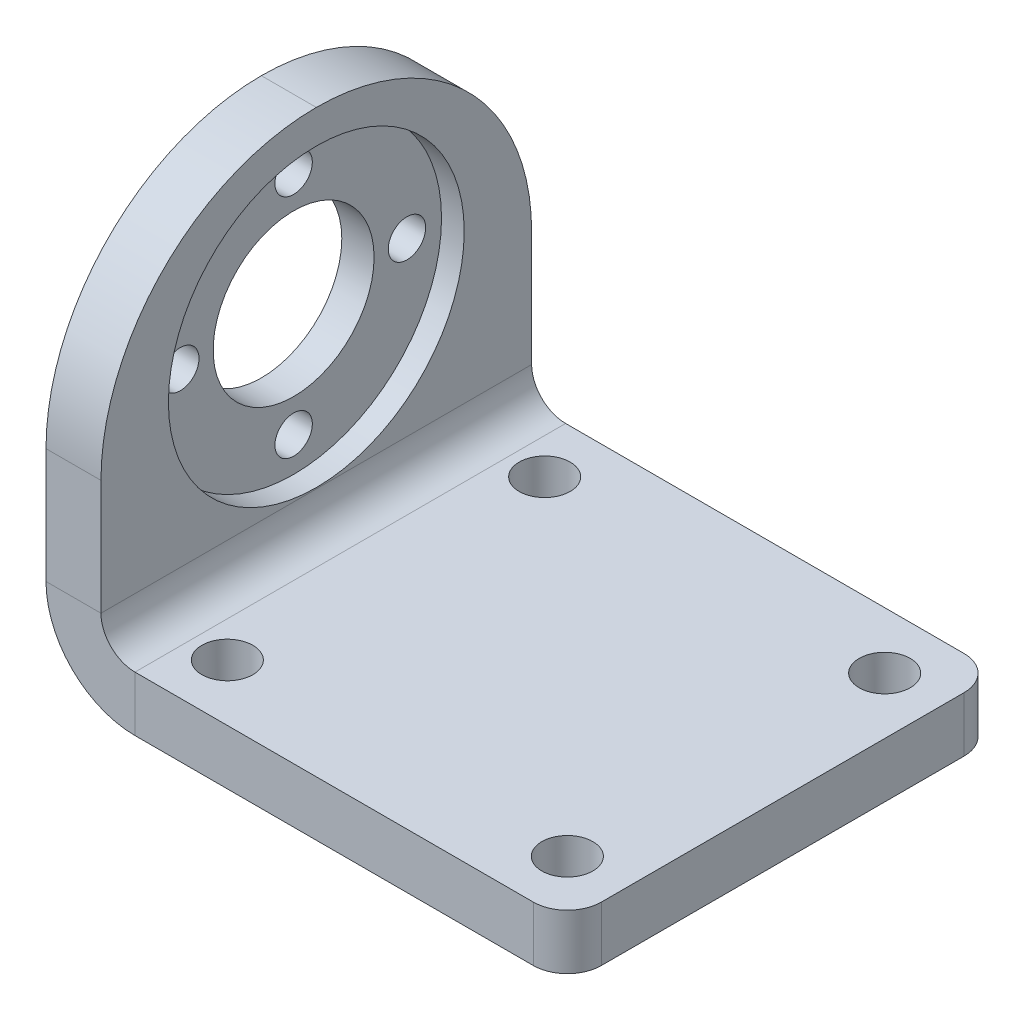
from build123d import *

# Parameters (mm, degrees)
T_LE_DE_BASE_PLI_E1_DEPTH    = 38
ENL_V_MAT_EXTRU_1_DEPTH      = 68.129147917
ENL_V_MAT_EXTRU_1_DEPTH_BACK = 68.129147917
ESQUISSE6_R                  = 7.1
ESQUISSE7_R                  = 13.05
ENL_V_MAT_EXTRU_2_DEPTH      = 2
CONG_1_R                     = 19
ENL_V_MAT_EXTRU_3_DEPTH      = 69.373404917
ENL_V_MAT_EXTRU_3_DEPTH_BACK = 69.373404917
ESQUISSE8_R                  = 1.65
ENL_V_MAT_EXTRU_4_DEPTH      = 68.77626797
ENL_V_MAT_EXTRU_4_DEPTH_BACK = 68.77626797
ESQUISSE9_R                  = 2.25
CONG_2_R                     = 3


# Read off the part's stored shape, not the designer's step: Tôle de base pliée1
with BuildPart() as part:
    # Tôle de base pliée1 outline → Tôle de base pliée1 (new body)
    with BuildSketch(Plane.XY):
        with BuildLine():
            Line((4.85, 7.85), (4.85, 37))
            Line((4.85, 37), (0, 37))
            Line((0, 37), (0, 7.85))
            ThreePointArc((0, 7.85), (2.299211768, 2.299211768), (7.85, 0))
            Line((7.85, 0), (46, 0))
            Line((46, 0), (46, 4.85))
            Line((46, 4.85), (7.85, 4.85))
            ThreePointArc((7.85, 4.85), (5.728679656, 5.728679656), (4.85, 7.85))
        make_face()
    extrude(amount=T_LE_DE_BASE_PLI_E1_DEPTH)

    # Esquisse6 → Enlèv. mat.-Extru.1 (cut, two sides: drawn at the far end of the back side and taken through both)
    with BuildSketch(Plane(origin=(4.85, 0, 0), x_dir=(0, 0, -1), z_dir=(1, 0, 0)).offset(-ENL_V_MAT_EXTRU_1_DEPTH_BACK)):
        with Locations((-19, 21)):
            Circle(ESQUISSE6_R)
    extrude(amount=ENL_V_MAT_EXTRU_1_DEPTH + ENL_V_MAT_EXTRU_1_DEPTH_BACK, mode=Mode.SUBTRACT)

    # Esquisse7 → Enlèv. mat.-Extru.2 (cut)
    with BuildSketch(Plane(origin=(4.85, 0, 0), x_dir=(0, 0, -1), z_dir=(1, 0, 0))):
        with Locations((-19, 21)):
            Circle(ESQUISSE7_R)
    extrude(amount=-ENL_V_MAT_EXTRU_2_DEPTH, mode=Mode.SUBTRACT)

    # Congé1
    cong_1_edges = [part.edges().sort_by_distance(p)[0] for p in [
        (2.425, 37, 0),
        (2.425, 37, 38),
    ]]
    fillet(cong_1_edges, radius=CONG_1_R - 0.0001)  # a hair under: the kernel refuses the full size

    # Esquisse8 → Enlèv. mat.-Extru.3 (cut, two sides: drawn at the far end of the back side and taken through both)
    with BuildSketch(Plane(origin=(2.85, 0, 0), x_dir=(0, 0, -1), z_dir=(1, 0, 0)).offset(-ENL_V_MAT_EXTRU_3_DEPTH_BACK)):
        with Locations((-9, 21)):
            Circle(ESQUISSE8_R)
        with Locations((-19, 11)):
            Circle(ESQUISSE8_R)
        with Locations((-29, 21)):
            Circle(ESQUISSE8_R)
        with Locations((-19, 31)):
            Circle(ESQUISSE8_R)
    extrude(amount=ENL_V_MAT_EXTRU_3_DEPTH + ENL_V_MAT_EXTRU_3_DEPTH_BACK, mode=Mode.SUBTRACT)

    # Esquisse9 → Enlèv. mat.-Extru.4 (cut, two sides: drawn at the far end of the back side and taken through both)
    with BuildSketch(Plane(origin=(0, 4.85, 0), x_dir=(1, 0, 0), z_dir=(0, 1, 0)).offset(-ENL_V_MAT_EXTRU_4_DEPTH_BACK)):
        with Locations(Location((41, -5, 0), (0, 0, 270))):
            Circle(ESQUISSE9_R)
        with Locations(Location((11, -5, 0), (0, 0, 90))):
            Circle(ESQUISSE9_R)
        with Locations(Location((11, -33, 0), (0, 0, 270))):
            Circle(ESQUISSE9_R)
        with Locations(Location((41, -33, 0), (0, 0, 90))):
            Circle(ESQUISSE9_R)
    extrude(amount=ENL_V_MAT_EXTRU_4_DEPTH + ENL_V_MAT_EXTRU_4_DEPTH_BACK, mode=Mode.SUBTRACT)

    # Congé2
    cong_2_edges = [part.edges().sort_by_distance(p)[0] for p in [
        (46, 2.425, 38),
        (46, 2.425, 0),
    ]]
    fillet(cong_2_edges, radius=CONG_2_R)


solid = part.part
